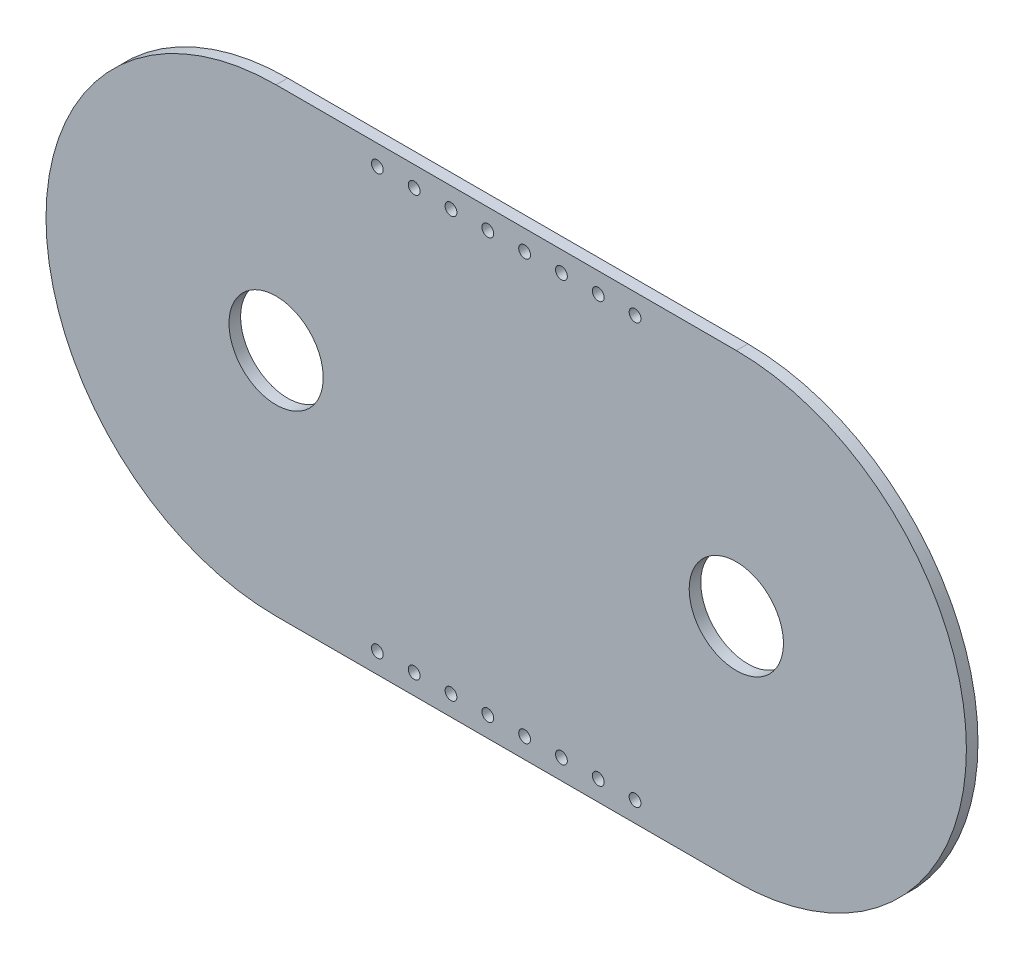
from build123d import *

# Parameters (mm, degrees)
SKETCH1_R           = 3.2512
BOSS_EXTRUDE1_DEPTH = 0.800000051
SKETCH3_R           = 0.4064
CUT_EXTRUDE3_DEPTH  = 58.243716905


with BuildPart() as part:
    # Sketch1 → Boss-Extrude1 (new body)
    with BuildSketch(Plane.XY):
        with BuildLine():
            Line((31.75, 31.75), (0, 31.75))
            ThreePointArc((0, 31.75), (-15.875, 15.875), (0, 0))
            Line((0, 0), (31.75, 0))
            ThreePointArc((31.75, 0), (47.625, 15.875), (31.75, 31.75))
        make_face()
        with Locations((0, 15.875)):
            Circle(SKETCH1_R, mode=Mode.SUBTRACT)
        with Locations((31.75, 15.875)):
            Circle(SKETCH1_R, mode=Mode.SUBTRACT)
    extrude(amount=BOSS_EXTRUDE1_DEPTH)

    # Sketch3 → Cut-Extrude3 (cut, through all)
    with BuildSketch(Plane(origin=(0, 0, 0.800000051), x_dir=(-1, 0, 0), z_dir=(0, 0, -1))):
        with Locations((-14.605, 30.353)):
            Circle(SKETCH3_R)
        with Locations((-12.065, 30.353)):
            Circle(SKETCH3_R)
        with Locations((-9.525, 30.353)):
            Circle(SKETCH3_R)
        with Locations((-6.985, 30.353)):
            Circle(SKETCH3_R)
        with Locations((-24.765, 30.353)):
            Circle(SKETCH3_R)
        with Locations((-22.225, 30.353)):
            Circle(SKETCH3_R)
        with Locations((-19.685, 30.353)):
            Circle(SKETCH3_R)
        with Locations((-17.145, 30.353)):
            Circle(SKETCH3_R)
        with Locations((-17.145, 1.397)):
            Circle(SKETCH3_R)
        with Locations((-19.685, 1.397)):
            Circle(SKETCH3_R)
        with Locations((-22.225, 1.397)):
            Circle(SKETCH3_R)
        with Locations((-24.765, 1.397)):
            Circle(SKETCH3_R)
        with Locations((-6.985, 1.397)):
            Circle(SKETCH3_R)
        with Locations((-9.525, 1.397)):
            Circle(SKETCH3_R)
        with Locations((-12.065, 1.397)):
            Circle(SKETCH3_R)
        with Locations((-14.605, 1.397)):
            Circle(SKETCH3_R)
    extrude(amount=CUT_EXTRUDE3_DEPTH, mode=Mode.SUBTRACT)


solid = part.part
